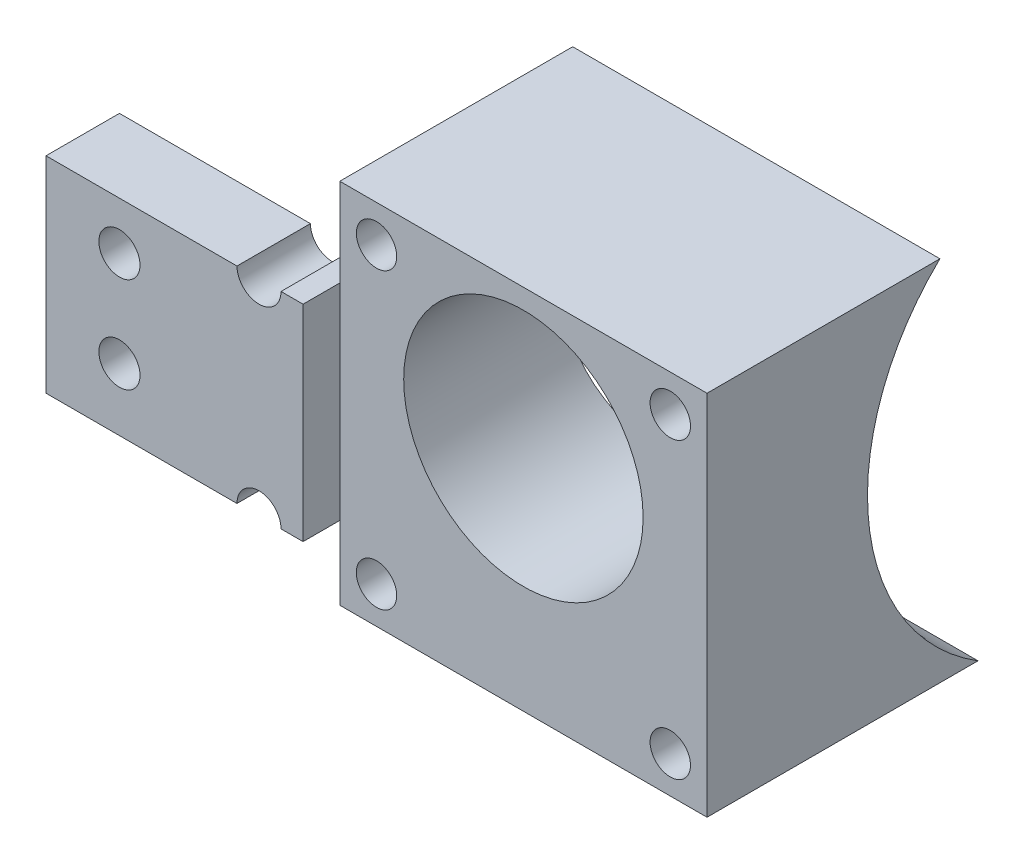
from build123d import *
from build123d.topology import SkipClean

# Parameters (mm, degrees)
SKETCH1_W               = 50
SKETCH1_H               = 50
SKETCH1_R               = 2.75
SKETCH1_R_2             = 16.3
BOSS_EXTRUDE1_DEPTH     = 53.6
CUT_EXTRUDE1_DEPTH      = 66.015075175
CUT_EXTRUDE1_DEPTH_BACK = 66.015075175
SKETCH2_R               = 31.75
BOSS_EXTRUDE3_START     = 35
BOSS_EXTRUDE3_DEPTH     = 35
SKETCH9_R               = 3
CUT_EXTRUDE5_DEPTH      = 85.864362462
CUT_EXTRUDE6_DEPTH      = 76.433606288
CUT_EXTRUDE6_DEPTH_BACK = 10
SKETCH10_R              = 2.8
CUT_EXTRUDE8_START      = -5
CUT_EXTRUDE8_DEPTH      = 71.433606288
BOSS_EXTRUDE4_START     = 5
SKETCH13_3_R            = 2.8
BOSS_EXTRUDE4_DEPTH     = 5
CUT_EXTRUDE9_DEPTH      = 5
CUT_EXTRUDE9_DEPTH_BACK = 5
SKETCH13_4_R            = 2.8


with BuildPart() as part:
    # Sketch1 → Boss-Extrude1 (new body)
    with BuildSketch(Plane.XY):
        with Locations((0, -2)):
            Rectangle(SKETCH1_W, SKETCH1_H)
        with Locations((-20, 18)):
            Circle(SKETCH1_R, mode=Mode.SUBTRACT)
        with Locations((20, 18)):
            Circle(SKETCH1_R, mode=Mode.SUBTRACT)
        with Locations((20, -22)):
            Circle(SKETCH1_R, mode=Mode.SUBTRACT)
        with Locations((-20, -22)):
            Circle(SKETCH1_R, mode=Mode.SUBTRACT)
        with Locations((0, 4)):
            Circle(SKETCH1_R_2, mode=Mode.SUBTRACT)
    extrude(amount=BOSS_EXTRUDE1_DEPTH)

    # Sketch2 → Cut-Extrude1 (cut, two sides: drawn at the far end of the back side and taken through both)
    with BuildSketch(Plane(origin=(0, 0, 0), x_dir=(0, 0, -1), z_dir=(1, 0, 0)).offset(-CUT_EXTRUDE1_DEPTH_BACK)):
        Circle(SKETCH2_R)
    extrude(amount=CUT_EXTRUDE1_DEPTH + CUT_EXTRUDE1_DEPTH_BACK, mode=Mode.SUBTRACT)

    # Sketch4 → Boss-Extrude3 (add)
    with SkipClean():  # the faces are left unmerged after this step: merging them gives an invalid solid
        with BuildSketch(Plane(origin=(25, 0, 0), x_dir=(0, 0, -1), z_dir=(1, 0, 0)).offset(BOSS_EXTRUDE3_START)):
            with BuildLine():
                Line((-53.6, 11), (-53.6, -17))
                Line((-53.6, -17), (-26.815340759, -17))
                ThreePointArc((-26.815340759, -17), (-31.573087709, -3.347033393), (-29.783594477, 11))
                Line((-29.783594477, 11), (-53.6, 11))
            make_face()
        boss_extrude3 = extrude(amount=-BOSS_EXTRUDE3_DEPTH)

    # Sketch9 → Cut-Extrude5 (cut, symmetric)
    with SkipClean():  # the faces are left unmerged after this step: merging them gives an invalid solid
        with BuildSketch(Plane.XY):
            with Locations((31, 11)):
                Circle(SKETCH9_R)
            with Locations((31, -17)):
                Circle(SKETCH9_R)
        cut_extrude5 = extrude(amount=CUT_EXTRUDE5_DEPTH, both=True, mode=Mode.SUBTRACT)

    # Sketch10 → Cut-Extrude6 (cut, two sides: drawn at the far end of the back side and taken through both)
    with SkipClean():  # the faces are left unmerged after this step: merging them gives an invalid solid
        with BuildSketch(Plane.XY.offset(53.6).offset(-CUT_EXTRUDE6_DEPTH_BACK)):
            with Locations((50, 4.5)):
                Circle(SKETCH10_R)
            with Locations((50, -8.5)):
                Circle(SKETCH10_R)
        extrude(amount=CUT_EXTRUDE6_DEPTH + CUT_EXTRUDE6_DEPTH_BACK, mode=Mode.SUBTRACT)

    # Sketch13 → Cut-Extrude8 (cut, through all)
    with BuildSketch(Plane.XY.offset(53.6).offset(CUT_EXTRUDE8_START)):
        with BuildLine():
            Line((60, -17), (60, 11))
            Line((60, 11), (34, 11))
            ThreePointArc((34, 11), (31, 8), (28, 11))
            Line((28, 11), (25, 11))
            Line((25, 11), (25, -17))
            Line((25, -17), (28, -17))
            ThreePointArc((28, -17), (31, -14), (34, -17))
            Line((34, -17), (60, -17))
        make_face()
    cut_extrude8 = extrude(amount=-CUT_EXTRUDE8_DEPTH, mode=Mode.SUBTRACT)

    # Sketch13<3> → Boss-Extrude4 (add)
    with SkipClean():  # the faces are left unmerged after this step: merging them gives an invalid solid
        with BuildSketch(Plane.XY.offset(53.6).offset(BOSS_EXTRUDE4_START)):
            with BuildLine():
                Line((60, 11), (60, -17))
                Line((60, -17), (34, -17))
                ThreePointArc((34, -17), (31, -14), (28, -17))
                Line((28, -17), (25, -17))
                Line((25, -17), (25, 11))
                Line((25, 11), (28, 11))
                ThreePointArc((28, 11), (31, 8), (34, 11))
                Line((34, 11), (60, 11))
            make_face()
            with Locations((50, 4.5)):
                Circle(SKETCH13_3_R, mode=Mode.SUBTRACT)
            with Locations((50, -8.5)):
                Circle(SKETCH13_3_R, mode=Mode.SUBTRACT)
        boss_extrude4 = extrude(amount=-BOSS_EXTRUDE4_DEPTH)
    add(part.part.scale(1), mode=Mode.REPLACE)  # the faces are merged on a copy

    # Mirror3: Boss-Extrude3, Cut-Extrude5, Cut-Extrude8, Boss-Extrude4 across plane
    with SkipClean():  # the faces are left unmerged after this step: merging them gives an invalid solid
        add(boss_extrude3.mirror(Plane(origin=(0, 0, 0), x_dir=(0, 0, 1), z_dir=(1, 0, 0))))
        add(cut_extrude5.mirror(Plane(origin=(0, 0, 0), x_dir=(0, 0, 1), z_dir=(1, 0, 0))), mode=Mode.SUBTRACT)
        add(cut_extrude8.mirror(Plane(origin=(0, 0, 0), x_dir=(0, 0, 1), z_dir=(1, 0, 0))), mode=Mode.SUBTRACT)
        add(boss_extrude4.mirror(Plane(origin=(0, 0, 0), x_dir=(0, 0, 1), z_dir=(1, 0, 0))))
    add(part.part.scale(1), mode=Mode.REPLACE)  # the faces are merged on a copy

    # Sketch13<4> → Cut-Extrude9 (cut, two sides: drawn at the far end of the back side and taken through both)
    with SkipClean():  # the faces are left unmerged after this step: merging them gives an invalid solid
        with BuildSketch(Plane.XY.offset(53.6).offset(-CUT_EXTRUDE9_DEPTH_BACK)):
            with BuildLine():
                Line((60, 11), (60, -17))
                Line((60, -17), (34, -17))
                ThreePointArc((34, -17), (31, -14), (28, -17))
                Line((28, -17), (25, -17))
                Line((25, -17), (25, 11))
                Line((25, 11), (28, 11))
                ThreePointArc((28, 11), (31, 8), (34, 11))
                Line((34, 11), (60, 11))
            make_face()
            with Locations((50, 4.5)):
                Circle(SKETCH13_4_R, mode=Mode.SUBTRACT)
            with Locations((50, -8.5)):
                Circle(SKETCH13_4_R, mode=Mode.SUBTRACT)
        extrude(amount=CUT_EXTRUDE9_DEPTH + CUT_EXTRUDE9_DEPTH_BACK, mode=Mode.SUBTRACT)


solid = part.part
